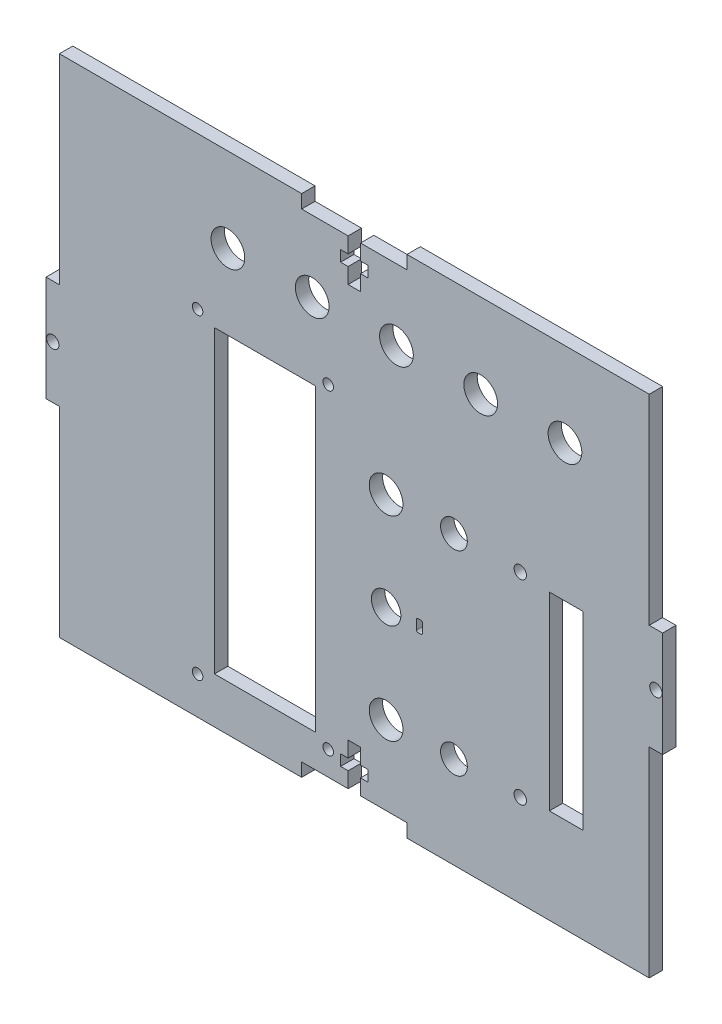
from build123d import *

# Parameters (mm, degrees)
SKETCH1_R           = 1.47
BOSS_EXTRUDE1_DEPTH = 1.5875
SKETCH3_W           = 8
SKETCH3_H           = 45
CUT_EXTRUDE1_DEPTH  = 95.681895049
SKETCH4_W           = 24
SKETCH4_H           = 71.2
CUT_EXTRUDE2_DEPTH  = 95.681895049
CUT_EXTRUDE4_DEPTH  = 95.681895049
SKETCH6_R           = 4
CUT_EXTRUDE5_DEPTH  = 95.681895049
SKETCH9_R           = 1.25
SKETCH9_R_2         = 1.47
CUT_EXTRUDE6_DEPTH  = 95.681895049
SKETCH12_R          = 4
SKETCH12_R_2        = 3.5
SKETCH12_R_3        = 3.175
CUT_EXTRUDE7_DEPTH  = 95.681895049


with BuildPart() as part:
    # Sketch1 → Boss-Extrude1 (new, symmetric)
    with BuildSketch(Plane.XY):
        Polygon((-12.5, 60), (-70, 60), (-70, 12.5), (-73.175, 12.5), (-73.175, -12.5), (-70, -12.5), (-70, -60), (-12.5, -60), (-12.5, -56.825), (-1.47, -56.825), (-1.47, -53.125), (-3.25, -53.125), (-3.25, -50.525), (-1.47, -50.525), (-1.47, -46.825), (1.47, -46.825), (1.47, -50.525), (3.25, -50.525), (3.25, -53.125), (1.47, -53.125), (1.47, -56.825), (12.5, -56.825), (12.5, -60), (70, -60), (70, -12.5), (73.175, -12.5), (73.175, 12.5), (70, 12.5), (70, 60), (12.5, 60), (12.5, 56.825), (1.47, 56.825), (1.47, 53.125), (3.25, 53.125), (3.25, 50.525), (1.47, 50.525), (1.47, 46.825), (-1.47, 46.825), (-1.47, 50.525), (-3.25, 50.525), (-3.25, 53.125), (-1.47, 53.125), (-1.47, 56.825), (-12.5, 56.825), align=None)
        with Locations((71.5875, 0)):
            Circle(SKETCH1_R, mode=Mode.SUBTRACT)
        with Locations((-71.5875, 0)):
            Circle(SKETCH1_R, mode=Mode.SUBTRACT)
    extrude(amount=BOSS_EXTRUDE1_DEPTH, both=True)

    # Sketch3 → Cut-Extrude1 (cut, through all)
    with BuildSketch(Plane(origin=(0, 0, -1.5875), x_dir=(-1, 0, 0), z_dir=(0, 0, -1))):
        with Locations((-50.3, -15)):
            Rectangle(SKETCH3_W, SKETCH3_H)
    extrude(amount=-CUT_EXTRUDE1_DEPTH, mode=Mode.SUBTRACT)

    # Sketch4 → Cut-Extrude2 (cut, through all)
    with BuildSketch(Plane(origin=(0, 0, -1.5875), x_dir=(-1, 0, 0), z_dir=(0, 0, -1))):
        with Locations((21.2, -13.494459363)):
            Rectangle(SKETCH4_W, SKETCH4_H)
    extrude(amount=-CUT_EXTRUDE2_DEPTH, mode=Mode.SUBTRACT)

    # Sketch5 → Cut-Extrude4 (cut, through all)
    with BuildSketch(Plane(origin=(0, 0, -1.5875), x_dir=(-1, 0, 0), z_dir=(0, 0, -1))):
        with BuildLine():
            Line((-15.153420736, -16.45), (-15.77915134, -16.45))
            ThreePointArc((-15.77915134, -16.45), (-16.043498683, -16.350200736), (-16.175937675, -16.10060241))
            ThreePointArc((-16.175937675, -16.10060241), (-16.245834875, -15), (-16.175937675, -13.89939759))
            ThreePointArc((-16.175937675, -13.89939759), (-16.043498683, -13.649799264), (-15.77915134, -13.55))
            Line((-15.77915134, -13.55), (-15.153420736, -13.55))
            ThreePointArc((-15.153420736, -13.55), (-14.870578023, -13.667157288), (-14.753420736, -13.95))
            Line((-14.753420736, -13.95), (-14.753420736, -16.05))
            ThreePointArc((-14.753420736, -16.05), (-14.870578023, -16.332842712), (-15.153420736, -16.45))
        make_face()
    extrude(amount=-CUT_EXTRUDE4_DEPTH, mode=Mode.SUBTRACT)

    # Sketch6 → Cut-Extrude5 (cut, through all)
    with BuildSketch(Plane(origin=(0, 0, -1.5875), x_dir=(-1, 0, 0), z_dir=(0, 0, -1))):
        with Locations((30, 40)):
            Circle(SKETCH6_R)
        with Locations((10, 40)):
            Circle(SKETCH6_R)
        with Locations((-10, 40)):
            Circle(SKETCH6_R)
        with Locations((-30, 40)):
            Circle(SKETCH6_R)
        with Locations((-50, 40)):
            Circle(SKETCH6_R)
    extrude(amount=-CUT_EXTRUDE5_DEPTH, mode=Mode.SUBTRACT)

    # Sketch9 → Cut-Extrude6 (cut, through all)
    with BuildSketch(Plane.XY.offset(1.5875)):
        with Locations((-37.2, 23.905540637)):
            Circle(SKETCH9_R)
        with Locations((-6.2, 23.905540637)):
            Circle(SKETCH9_R)
        with Locations((-6.2, -51.094459363)):
            Circle(SKETCH9_R)
        with Locations((-37.2, -51.094459363)):
            Circle(SKETCH9_R)
        with Locations((39.3875, 8.16125846)):
            Circle(SKETCH9_R_2)
        with Locations((39.3875, -38.16125846)):
            Circle(SKETCH9_R_2)
    extrude(amount=-CUT_EXTRUDE6_DEPTH, mode=Mode.SUBTRACT)

    # Sketch12 → Cut-Extrude7 (cut, through all)
    with BuildSketch(Plane(origin=(0, 0, -1.5875), x_dir=(-1, 0, 0), z_dir=(0, 0, -1))):
        with Locations((-7.545834875, -38.16125846)):
            Circle(SKETCH12_R)
        with Locations((-7.545834875, 8.16125846)):
            Circle(SKETCH12_R)
        with Locations((-7.545834875, -15)):
            Circle(SKETCH12_R_2)
        with Locations((-23.65, -38.16125846)):
            Circle(SKETCH12_R_3)
        with Locations((-23.65, 8.16125846)):
            Circle(SKETCH12_R_3)
    extrude(amount=-CUT_EXTRUDE7_DEPTH, mode=Mode.SUBTRACT)


solid = part.part
